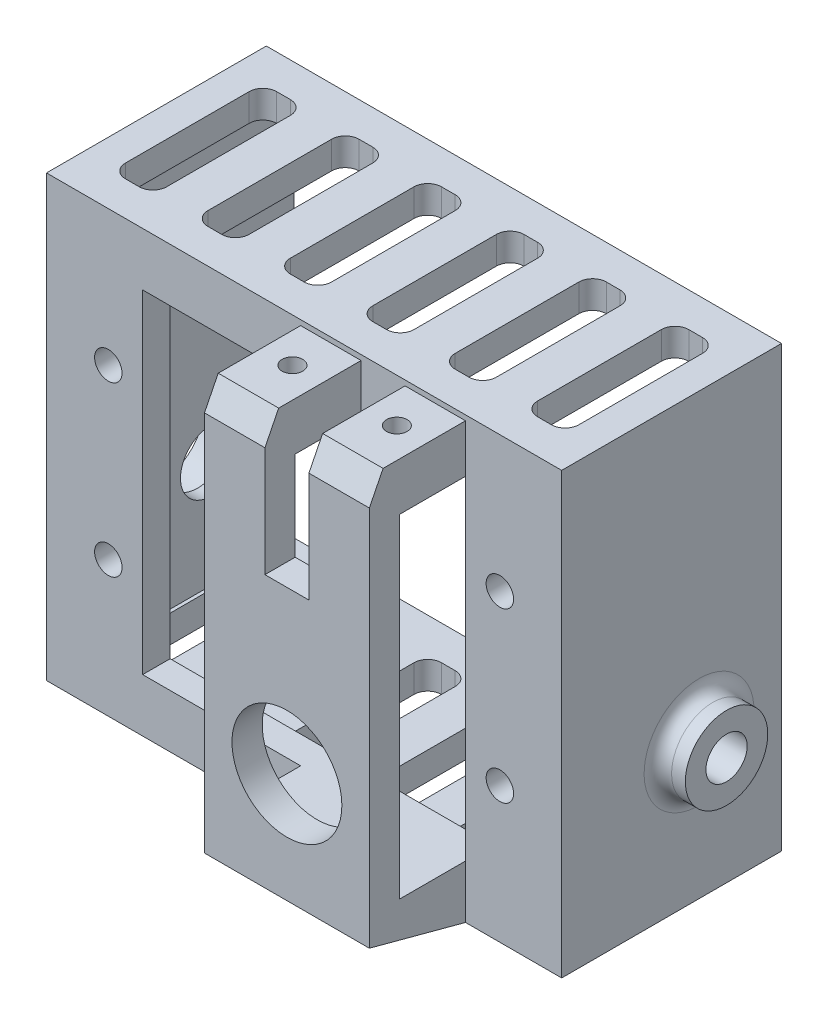
from build123d import *
from OCP.BRepFilletAPI import BRepFilletAPI_MakeChamfer

# Parameters (mm, degrees)
SKETCH_1_W          = 33.5
SKETCH_1_H          = 32
SKETCH_1_R          = 1
SKETCH_1_W_2        = 23.5
SKETCH_1_H_2        = 24.25
EXTRUDE_1_DEPTH     = 2
SKETCH_2_W          = 12
SKETCH_2_H          = 12
SKETCH_2_R          = 4
EXTRUDE_2_DEPTH     = 2.2
EXTRUDE_3_DEPTH     = 12
EXTRUDE_4_DEPTH     = 12
SKETCH_5_W          = 33.5
SKETCH_5_H          = 2
EXTRUDE_5_DEPTH     = 14
SKETCH_7_W          = 2
SKETCH_7_H          = 32
EXTRUDE_6_DEPTH     = 16
SKETCH_9_R          = 3.625
CUT_EXTRUDE_1_DEPTH = 1
SKETCH_10_R         = 2.25
CUT_EXTRUDE_2_DEPTH = 1
EXTRUDE_START       = -2
SKETCH_11_R         = 5
SKETCH_11_R_2       = 3.625
EXTRUDE_7_DEPTH     = 2
FILLET_1_R          = 1
SKETCH_12_R         = 3
SKETCH_12_R_2       = 1.5
EXTRUDE_8_DEPTH     = 2
FILLET_2_R          = 1
CUT_EXTRUDE_START   = 2
SKETCH_13_R         = 1.5
CUT_EXTRUDE_3_DEPTH = 2
SKETCH_19_W         = 3.200973594
SKETCH_19_H         = 7
CUT_EXTRUDE_7_DEPTH = 10
CUT_EXTRUDE_8_DEPTH = 42
SKETCH_22_R         = 0.75
CUT_EXTRUDE_9_DEPTH = 5
CHAMFER_1_SIZE      = 1
CHAMFER_1_SIZE2     = 2


with BuildPart() as part:
    # 草图1 → 凸台-拉伸1 (new body)
    with BuildSketch(Plane.XY):
        with Locations((-5.75, -6.125)):
            Rectangle(SKETCH_1_W, SKETCH_1_H)
        with Locations((-20, 0)):
            Circle(SKETCH_1_R, mode=Mode.SUBTRACT)
        with Locations(Location((8.5, 0, 0), (0, 0, 180))):
            Circle(SKETCH_1_R, mode=Mode.SUBTRACT)
        with Locations(Location((-20, -12.25, 0), (0, 0, 180))):
            Circle(SKETCH_1_R, mode=Mode.SUBTRACT)
        with Locations((8.5, -12.25)):
            Circle(SKETCH_1_R, mode=Mode.SUBTRACT)
        with Locations((-5.75, -6.125)):
            Rectangle(SKETCH_1_W_2, SKETCH_1_H_2, mode=Mode.SUBTRACT)
    extrude(amount=EXTRUDE_1_DEPTH)



with BuildPart() as body_2:
    # 草图2 → 凸台-拉伸2 (new body)
    with BuildSketch(Plane.XY.offset(9)):
        with Locations((0, -12.25)):
            Rectangle(SKETCH_2_W, SKETCH_2_H)
        with Locations((0, -12.25)):
            Circle(SKETCH_2_R, mode=Mode.SUBTRACT)
    extrude(amount=-EXTRUDE_2_DEPTH)


with BuildPart() as part_1:
    add(part.part)

    add(body_2.part)  # 凸台-拉伸3 merges body 2
    # 草图3 → 凸台-拉伸3 (add)
    with BuildSketch(Plane.ZY.offset(6)):
        Polygon((9, -18.25), (2, -18.25), (2, -22.125), (9, -20.25), align=None)
    extrude(amount=-EXTRUDE_3_DEPTH)

    # 草图4 → 凸台-拉伸4 (add)
    with BuildSketch(Plane.ZY.offset(6)):
        Polygon((6.8, -6.25), (9, -6.25), (9, 9.5), (2, 9.5), (2, 6), (6.8, 6), align=None)
    extrude(amount=-EXTRUDE_4_DEPTH)

    # 草图5 → 凸台-拉伸5 (add)
    with BuildSketch(Plane(origin=(0, 0, 0), x_dir=(-1, 0, 0), z_dir=(0, 0, -1))):
        with Locations((5.75, 8.875)):
            Rectangle(SKETCH_5_W, SKETCH_5_H)
        with Locations((5.75, -21.125)):
            Rectangle(SKETCH_5_W, SKETCH_5_H)
    extrude(amount=EXTRUDE_5_DEPTH)

    # 草图7 → 凸台-拉伸6 (add)
    with BuildSketch(Plane.XY.offset(2)):
        with Locations((-23.5, -6.125)):
            Rectangle(SKETCH_7_W, SKETCH_7_H)
        with Locations((12, -6.125)):
            Rectangle(SKETCH_7_W, SKETCH_7_H)
    extrude(amount=-EXTRUDE_6_DEPTH)

    # 草图9 → 切除-拉伸1 (cut)
    with BuildSketch(Plane(origin=(-24.5, 0, 0), x_dir=(0, 0, -1), z_dir=(1, 0, 0))):
        with Locations(Location((8, -12.25, 0), (0, 0, 90))):
            Circle(SKETCH_9_R)
    extrude(amount=CUT_EXTRUDE_1_DEPTH, mode=Mode.SUBTRACT)

    # 草图10 → 切除-拉伸2 (cut)
    with BuildSketch(Plane.ZY.offset(23.5)):
        with Locations(Location((-8, -12.25, 0), (0, 0, 270))):
            Circle(SKETCH_10_R)
    extrude(amount=-CUT_EXTRUDE_2_DEPTH, mode=Mode.SUBTRACT)

    # 草图11 → 凸台-拉伸7 (add)
    with BuildSketch(Plane(origin=(-24.5, 0, 0), x_dir=(0, 0, -1), z_dir=(1, 0, 0)).offset(EXTRUDE_START)):
        with Locations(Location((8, -12.25, 0), (0, 0, 90))):
            Circle(SKETCH_11_R)
        with Locations(Location((8, -12.25, 0), (0, 0, 90))):
            Circle(SKETCH_11_R_2, mode=Mode.SUBTRACT)
    extrude(amount=EXTRUDE_7_DEPTH)

    # 圆角1
    fillet_1_edges = [part_1.edges().sort_by_distance(p)[0] for p in [
        (-24.5, -17.25, -8),
    ]]
    fillet(fillet_1_edges, radius=FILLET_1_R - 0.0001)  # a hair under: the kernel refuses the full size

    # 草图12 → 凸台-拉伸8 (add)
    with BuildSketch(Plane.ZY.offset(-13)):
        with Locations(Location((-8, -12.25, 0), (0, 0, 270))):
            Circle(SKETCH_12_R)
        with Locations(Location((-8, -12.25, 0), (0, 0, 270))):
            Circle(SKETCH_12_R_2, mode=Mode.SUBTRACT)
    extrude(amount=-EXTRUDE_8_DEPTH)

    # 圆角2
    fillet_2_edges = [part_1.edges().sort_by_distance(p)[0] for p in [
        (13, -9.25, -8),
    ]]
    fillet(fillet_2_edges, radius=FILLET_2_R)

    # 草图13 → 切除-拉伸3 (cut)
    with BuildSketch(Plane.ZY.offset(-13).offset(CUT_EXTRUDE_START)):
        with Locations(Location((-8, -12.25, 0), (0, 0, 270))):
            Circle(SKETCH_13_R)
    extrude(amount=-CUT_EXTRUDE_3_DEPTH, mode=Mode.SUBTRACT)

    # 草图19 → 切除-拉伸7 (cut)
    with BuildSketch(Plane(origin=(0, 9.5, 0), x_dir=(1, 0, 0), z_dir=(0, 1, 0))):
        with Locations((0, -5.5)):
            Rectangle(SKETCH_19_W, SKETCH_19_H)
    extrude(amount=-CUT_EXTRUDE_7_DEPTH, mode=Mode.SUBTRACT)

    # 草图20 → 切除-拉伸8 (cut)
    with BuildSketch(Plane(origin=(0, 9.875, 0), x_dir=(1, 0, 0), z_dir=(0, 1, 0))):
        with BuildLine():
            Line((-7.25, 10.5), (-7.25, 1.5))
            ThreePointArc((-7.25, 1.5), (-7.542893219, 0.792893219), (-8.25, 0.5))
            Line((-8.25, 0.5), (-9.25, 0.5))
            ThreePointArc((-9.25, 0.5), (-9.957106781, 0.792893219), (-10.25, 1.5))
            Line((-10.25, 1.5), (-10.25, 10.5))
            ThreePointArc((-10.25, 10.5), (-9.957106781, 11.207106781), (-9.25, 11.5))
            Line((-9.25, 11.5), (-8.25, 11.5))
            ThreePointArc((-8.25, 11.5), (-7.542893219, 11.207106781), (-7.25, 10.5))
        make_face()
        with BuildLine():
            Line((7.75, 10.5), (7.75, 1.5))
            ThreePointArc((7.75, 1.5), (8.042893219, 0.792893219), (8.75, 0.5))
            Line((8.75, 0.5), (9.75, 0.5))
            ThreePointArc((9.75, 0.5), (10.457106781, 0.792893219), (10.75, 1.5))
            Line((10.75, 1.5), (10.75, 10.5))
            ThreePointArc((10.75, 10.5), (10.457106781, 11.207106781), (9.75, 11.5))
            Line((9.75, 11.5), (8.75, 11.5))
            ThreePointArc((8.75, 11.5), (8.042893219, 11.207106781), (7.75, 10.5))
        make_face()
        with BuildLine():
            Line((-15.25, 11.5), (-14.25, 11.5))
            ThreePointArc((-14.25, 11.5), (-13.542893219, 11.207106781), (-13.25, 10.5))
            Line((-13.25, 10.5), (-13.25, 1.5))
            ThreePointArc((-13.25, 1.5), (-13.542893219, 0.792893219), (-14.25, 0.5))
            Line((-14.25, 0.5), (-15.25, 0.5))
            ThreePointArc((-15.25, 0.5), (-15.957106781, 0.792893219), (-16.25, 1.5))
            Line((-16.25, 1.5), (-16.25, 10.5))
            ThreePointArc((-16.25, 10.5), (-15.957106781, 11.207106781), (-15.25, 11.5))
        make_face()
        with BuildLine():
            Line((-21.25, 11.5), (-20.25, 11.5))
            ThreePointArc((-20.25, 11.5), (-19.542893219, 11.207106781), (-19.25, 10.5))
            Line((-19.25, 10.5), (-19.25, 1.5))
            ThreePointArc((-19.25, 1.5), (-19.542893219, 0.792893219), (-20.25, 0.5))
            Line((-20.25, 0.5), (-21.25, 0.5))
            ThreePointArc((-21.25, 0.5), (-21.957106781, 0.792893219), (-22.25, 1.5))
            Line((-22.25, 1.5), (-22.25, 10.5))
            ThreePointArc((-22.25, 10.5), (-21.957106781, 11.207106781), (-21.25, 11.5))
        make_face()
        with BuildLine():
            Line((1.75, 10.5), (1.75, 1.5))
            ThreePointArc((1.75, 1.5), (2.042893219, 0.792893219), (2.75, 0.5))
            Line((2.75, 0.5), (3.75, 0.5))
            ThreePointArc((3.75, 0.5), (4.457106781, 0.792893219), (4.75, 1.5))
            Line((4.75, 1.5), (4.75, 10.5))
            ThreePointArc((4.75, 10.5), (4.457106781, 11.207106781), (3.75, 11.5))
            Line((3.75, 11.5), (2.75, 11.5))
            ThreePointArc((2.75, 11.5), (2.042893219, 11.207106781), (1.75, 10.5))
        make_face()
        with BuildLine():
            Line((-2.25, 11.5), (-3.25, 11.5))
            ThreePointArc((-3.25, 11.5), (-3.957106781, 11.207106781), (-4.25, 10.5))
            Line((-4.25, 10.5), (-4.25, 1.5))
            ThreePointArc((-4.25, 1.5), (-3.957106781, 0.792893219), (-3.25, 0.5))
            Line((-3.25, 0.5), (-2.25, 0.5))
            ThreePointArc((-2.25, 0.5), (-1.542893219, 0.792893219), (-1.25, 1.5))
            Line((-1.25, 1.5), (-1.25, 10.5))
            ThreePointArc((-1.25, 10.5), (-1.542893219, 11.207106781), (-2.25, 11.5))
        make_face()
    extrude(amount=-CUT_EXTRUDE_8_DEPTH, mode=Mode.SUBTRACT)

    # 草图22 → 切除-拉伸9 (cut)
    with BuildSketch(Plane(origin=(0, 9.5, 0), x_dir=(1, 0, 0), z_dir=(0, 1, 0))):
        with Locations(Location((3.8, -4.8, 0), (0, 0, 270))):
            Circle(SKETCH_22_R)
        with Locations((-3.8, -4.8)):
            Circle(SKETCH_22_R)
    extrude(amount=-CUT_EXTRUDE_9_DEPTH, mode=Mode.SUBTRACT)

    # 倒角1: one chamfer whose edges measure the first distance from different faces: ONE call of the kernel's chamfer builder (chamfer() names one face for all edges)
    chamfer_1_edges_1 = [part_1.edges().sort_by_distance(p)[0] for p in [
        (-3.800243398, 9.5, 9),
    ]]
    chamfer_1_side_1 = [part_1.faces().sort_by_distance(p)[0] for p in [
        (-5.917322484, 9.5, 5.5),
    ]]
    chamfer_1_edges_2 = [part_1.edges().sort_by_distance(p)[0] for p in [
        (3.800243398, 9.5, 9),
    ]]
    chamfer_1_side_2 = [part_1.faces().sort_by_distance(p)[0] for p in [
        (1.683164313, 9.5, 5.5),
    ]]
    chamfer_1 = BRepFilletAPI_MakeChamfer(part_1.part.solid().wrapped)
    for e in chamfer_1_edges_1:
        chamfer_1.Add(CHAMFER_1_SIZE, CHAMFER_1_SIZE2, e.wrapped, chamfer_1_side_1[0].wrapped)  # the first distance lies on this face
    for e in chamfer_1_edges_2:
        chamfer_1.Add(CHAMFER_1_SIZE, CHAMFER_1_SIZE2, e.wrapped, chamfer_1_side_2[0].wrapped)  # the first distance lies on this face
    add(Compound.cast(chamfer_1.Shape()), mode=Mode.REPLACE)


solid = part_1.part
